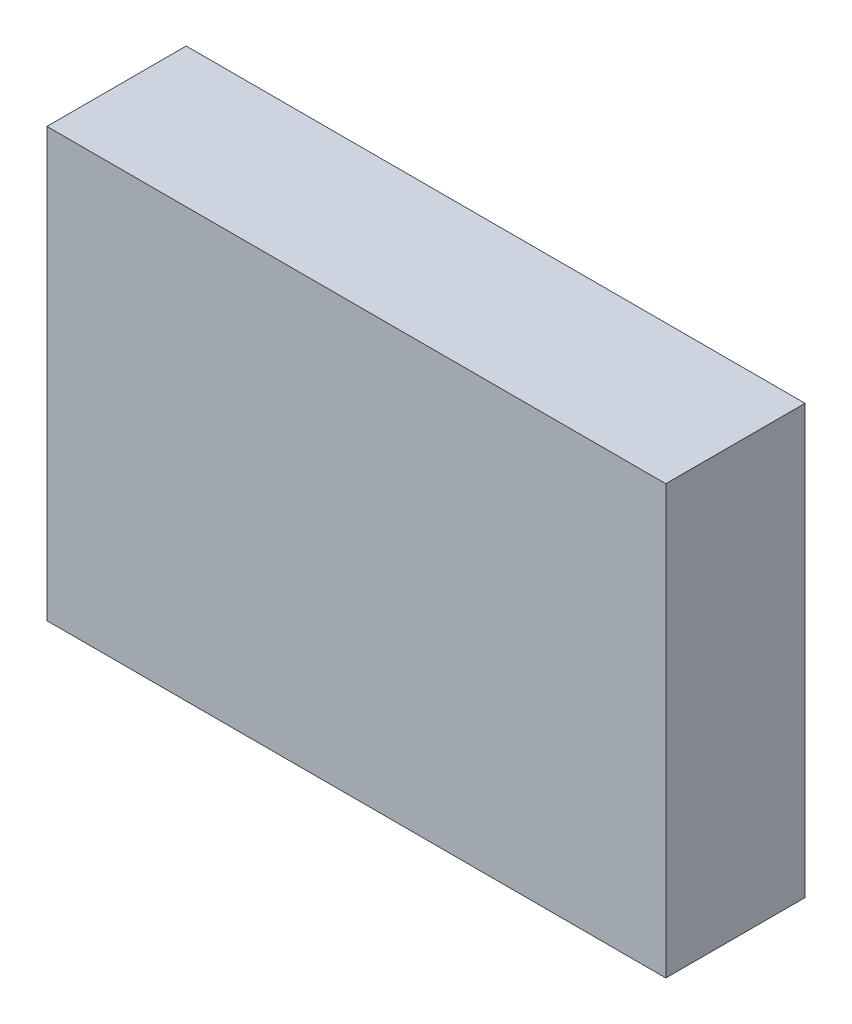
from build123d import *

# Parameters (mm, degrees)
SKETCH2_W           = 120
SKETCH2_H           = 83
BOSS_EXTRUDE1_DEPTH = 27


with BuildPart() as part:
    # Sketch2 → Boss-Extrude1 (new body)
    with BuildSketch(Plane.XY):
        with Locations((60, 41.5)):
            Rectangle(SKETCH2_W, SKETCH2_H)
    extrude(amount=BOSS_EXTRUDE1_DEPTH)


solid = part.part
